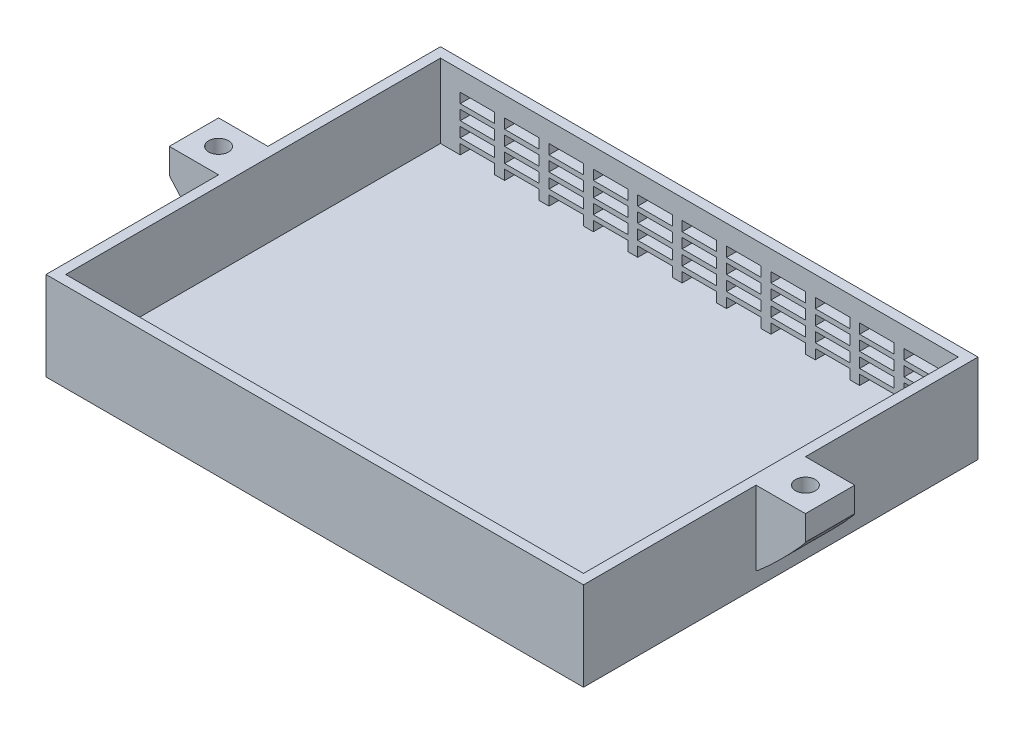
from build123d import *

# Parameters (mm, degrees)
SKETCH1_W           = 87.2
SKETCH1_H           = 64
BOSS_EXTRUDE1_DEPTH = 2.4
SKETCH2_W           = 87.2
SKETCH2_H           = 64
SKETCH2_W_2         = 84
SKETCH2_H_2         = 60.8
BOSS_EXTRUDE2_DEPTH = 12
SKETCH4_W           = 5.6
SKETCH4_H           = 1.6
CUT_EXTRUDE1_DEPTH  = 12
SKETCH7_W           = 8
SKETCH7_H           = 8
SKETCH7_R           = 1.6
BOSS_EXTRUDE4_DEPTH = 12
FILLET2_SIZE        = 8


with BuildPart() as part:
    # Sketch1 → Boss-Extrude1 (new body)
    with BuildSketch(Plane(origin=(0, 0, 0), x_dir=(1, 0, 0), z_dir=(0, 1, 0))):
        with Locations((43.6, -32)):
            Rectangle(SKETCH1_W, SKETCH1_H)
    extrude(amount=BOSS_EXTRUDE1_DEPTH)

    # Sketch2 → Boss-Extrude2 (add)
    with BuildSketch(Plane(origin=(0, 2.4, 0), x_dir=(1, 0, 0), z_dir=(0, 1, 0))):
        with Locations((43.6, -32)):
            Rectangle(SKETCH2_W, SKETCH2_H)
        with Locations((43.6, -32)):
            Rectangle(SKETCH2_W_2, SKETCH2_H_2, mode=Mode.SUBTRACT)
    extrude(amount=BOSS_EXTRUDE2_DEPTH)

    # Sketch4 → Cut-Extrude1 (cut)
    with BuildSketch(Plane(origin=(0, 0, 0), x_dir=(-1, 0, 0), z_dir=(0, 0, -1))):
        with Locations((-7.6, 3.2)):
            Rectangle(SKETCH4_W, SKETCH4_H)
        with Locations((-14.8, 3.2)):
            Rectangle(SKETCH4_W, SKETCH4_H)
        with Locations((-22, 3.2)):
            Rectangle(SKETCH4_W, SKETCH4_H)
        with Locations((-29.2, 3.2)):
            Rectangle(SKETCH4_W, SKETCH4_H)
        with Locations((-36.4, 3.2)):
            Rectangle(SKETCH4_W, SKETCH4_H)
        with Locations((-43.6, 3.2)):
            Rectangle(SKETCH4_W, SKETCH4_H)
        with Locations((-50.8, 3.2)):
            Rectangle(SKETCH4_W, SKETCH4_H)
        with Locations((-58, 3.2)):
            Rectangle(SKETCH4_W, SKETCH4_H)
        with Locations((-14.8, 5.6)):
            Rectangle(SKETCH4_W, SKETCH4_H)
        with Locations((-22, 5.6)):
            Rectangle(SKETCH4_W, SKETCH4_H)
        with Locations((-29.2, 5.6)):
            Rectangle(SKETCH4_W, SKETCH4_H)
        with Locations((-36.4, 5.6)):
            Rectangle(SKETCH4_W, SKETCH4_H)
        with Locations((-43.6, 5.6)):
            Rectangle(SKETCH4_W, SKETCH4_H)
        with Locations((-50.8, 5.6)):
            Rectangle(SKETCH4_W, SKETCH4_H)
        with Locations((-58, 5.6)):
            Rectangle(SKETCH4_W, SKETCH4_H)
        with Locations((-14.8, 8)):
            Rectangle(SKETCH4_W, SKETCH4_H)
        with Locations((-22, 8)):
            Rectangle(SKETCH4_W, SKETCH4_H)
        with Locations((-29.2, 8)):
            Rectangle(SKETCH4_W, SKETCH4_H)
        with Locations((-36.4, 8)):
            Rectangle(SKETCH4_W, SKETCH4_H)
        with Locations((-43.6, 8)):
            Rectangle(SKETCH4_W, SKETCH4_H)
        with Locations((-50.8, 8)):
            Rectangle(SKETCH4_W, SKETCH4_H)
        with Locations((-58, 8)):
            Rectangle(SKETCH4_W, SKETCH4_H)
        with Locations((-7.6, 5.6)):
            Rectangle(SKETCH4_W, SKETCH4_H)
        with Locations((-7.6, 8)):
            Rectangle(SKETCH4_W, SKETCH4_H)
        with Locations((-7.6, 10.4)):
            Rectangle(SKETCH4_W, SKETCH4_H)
        with Locations((-14.8, 10.4)):
            Rectangle(SKETCH4_W, SKETCH4_H)
        with Locations((-22, 10.4)):
            Rectangle(SKETCH4_W, SKETCH4_H)
        with Locations((-29.2, 10.4)):
            Rectangle(SKETCH4_W, SKETCH4_H)
        with Locations((-36.4, 10.4)):
            Rectangle(SKETCH4_W, SKETCH4_H)
        with Locations((-43.6, 10.4)):
            Rectangle(SKETCH4_W, SKETCH4_H)
        with Locations((-50.8, 10.4)):
            Rectangle(SKETCH4_W, SKETCH4_H)
        with Locations((-58, 10.4)):
            Rectangle(SKETCH4_W, SKETCH4_H)
        with Locations((-65.2, 3.2)):
            Rectangle(SKETCH4_W, SKETCH4_H)
        with Locations((-72.4, 3.2)):
            Rectangle(SKETCH4_W, SKETCH4_H)
        with Locations((-79.6, 3.2)):
            Rectangle(SKETCH4_W, SKETCH4_H)
        with Locations((-65.2, 5.6)):
            Rectangle(SKETCH4_W, SKETCH4_H)
        with Locations((-72.4, 5.6)):
            Rectangle(SKETCH4_W, SKETCH4_H)
        with Locations((-79.6, 5.6)):
            Rectangle(SKETCH4_W, SKETCH4_H)
        with Locations((-65.2, 8)):
            Rectangle(SKETCH4_W, SKETCH4_H)
        with Locations((-72.4, 8)):
            Rectangle(SKETCH4_W, SKETCH4_H)
        with Locations((-79.6, 8)):
            Rectangle(SKETCH4_W, SKETCH4_H)
        with Locations((-65.2, 10.4)):
            Rectangle(SKETCH4_W, SKETCH4_H)
        with Locations((-72.4, 10.4)):
            Rectangle(SKETCH4_W, SKETCH4_H)
        with Locations((-79.6, 10.4)):
            Rectangle(SKETCH4_W, SKETCH4_H)
    extrude(amount=-CUT_EXTRUDE1_DEPTH, mode=Mode.SUBTRACT)

    # Sketch7 → Boss-Extrude4 (add)
    # profile 1 of 2: a face of its own
    with BuildSketch(Plane(origin=(0, 14.4, 0), x_dir=(1, 0, 0), z_dir=(0, 1, 0))):
        with Locations((91.2, -32)):
            Rectangle(SKETCH7_W, SKETCH7_H)
        with Locations(Location((91.2, -32, 0), (0, 0, 270))):
            Circle(SKETCH7_R, mode=Mode.SUBTRACT)
    # profile 2 of 2: a face of its own
    with BuildSketch(Plane(origin=(0, 14.4, 0), x_dir=(1, 0, 0), z_dir=(0, 1, 0))):
        with Locations((-4, -32)):
            Rectangle(SKETCH7_W, SKETCH7_H)
        with Locations(Location((-4, -32, 0), (0, 0, 90))):
            Circle(SKETCH7_R, mode=Mode.SUBTRACT)
    extrude(amount=-BOSS_EXTRUDE4_DEPTH)

    # Fillet2
    # a fillet whose section is not a circle: 8 mm, written as the material it takes off along each edge
    with BuildSketch(Plane(origin=(-8, 2.4, 8), x_dir=(1, 0, 0), z_dir=(0, 0, 1)), Plane(origin=(95.2, 2.4, 56), x_dir=(-1, 0, 0), z_dir=(0, 0, -1))) as fillet2_piece_1:
        with BuildLine():
            Bezier((FILLET2_SIZE, 0), (0, 0), (0, FILLET2_SIZE), weights=[1, 0.052631579, 1])
            Line((0, FILLET2_SIZE), (0, 0))
            Line((0, 0), (FILLET2_SIZE, 0))
        make_face()
    extrude(amount=48, mode=Mode.SUBTRACT)


solid = part.part
